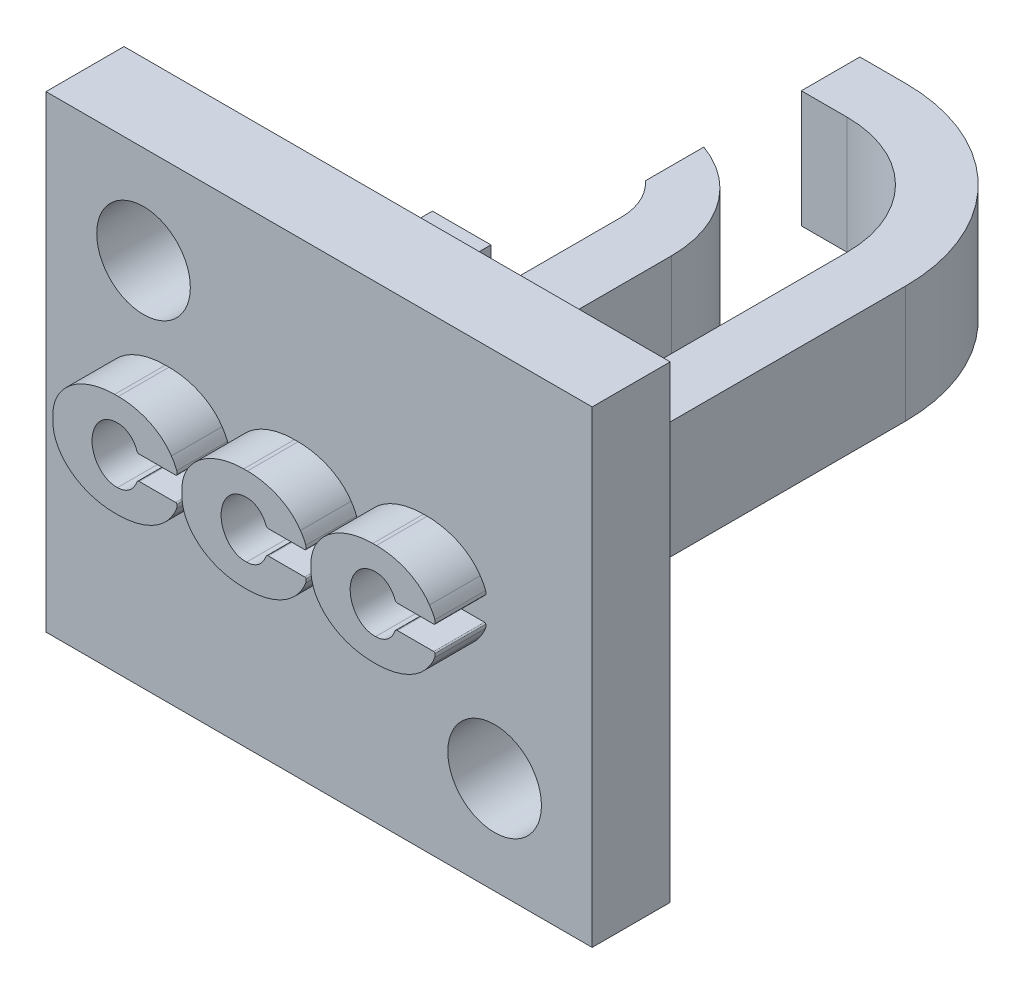
from build123d import *

# Parameters (mm, degrees)
SKETCH1_W           = 15
SKETCH1_H           = 12
BOSS_EXTRUDE1_DEPTH = 2
BOSS_EXTRUDE2_DEPTH = 2
SKETCH3_W           = 1.5
SKETCH3_H           = 4.8
BOSS_EXTRUDE3_DEPTH = 1.5
FILLET3_START       = -1.5
FILLET3_DEPTH       = 3
FILLET4_R           = 3
FILLET5_R           = 3
FILLET6_R           = 4.5
SKETCH4_W           = 2
SKETCH4_H           = 12
CUT_EXTRUDE1_DEPTH  = 1
SKETCH5_R           = 1.2
CUT_EXTRUDE2_DEPTH  = 17.731407672
CUT_EXTRUDE3_START  = -0.7
CUT_EXTRUDE3_DEPTH  = 0.7


with BuildPart() as part:
    # Sketch1 → Boss-Extrude1 (new body)
    with BuildSketch(Plane.XY):
        Rectangle(SKETCH1_W, SKETCH1_H)
    extrude(amount=BOSS_EXTRUDE1_DEPTH)

    # Sketch2 → Boss-Extrude2 (add)
    with BuildSketch(Plane.XY.offset(2)):
        with BuildLine():
            Line((-0.500488048, 0.447210694), (0.435347045, 0.447210694))
            ThreePointArc((0.435347045, 0.447210694), (0.453657173, 0.45529852), (0.464590943, 0.472065344))
            ThreePointArc((0.464590943, 0.472065344), (0.467777397, 0.516057125), (0.460402384, 0.559543208))
            ThreePointArc((0.460402384, 0.559543208), (0.399954535, 0.692528449), (0.323240273, 0.816842321))
            add(Edge.make_bspline(
                [(0.323240273, 0.816842321), (-0.095057279, 1.457976678), (-1.037858727, 1.457976694)],
                knots=[0.342748392, 0.342748392, 0.342748392, 1.381331674, 1.381331674, 1.381331674], degree=2, weights=[1, 0.868170932, 1]))
            Line((-1.037858727, 1.457976694), (-1.131479815, 1.457976694))
            add(Edge.make_bspline(
                [(-1.131479815, 1.457976694), (-2.717136663, 1.457976694), (-2.717136676, 0.206821629)],
                knots=[4.81203319, 4.81203319, 4.81203319, 6.344970318, 6.344970318, 6.344970318], degree=2, weights=[1, 0.720364545, 1]))
            Line((-2.717136676, 0.206821629), (-2.717136676, 0.076691364))
            add(Edge.make_bspline(
                [(-2.717136676, 0.076691364), (-2.717136676, -1.174463735), (-1.131479784, -1.174463712)],
                knots=[3.079807634, 3.079807634, 3.079807634, 4.61274479, 4.61274479, 4.61274479], degree=2, weights=[1, 0.720364535, 1]))
            Line((-1.131479784, -1.174463712), (-1.037858761, -1.174463712))
            add(Edge.make_bspline(
                [(-1.037858761, -1.174463712), (-0.095057289, -1.174463712), (0.323240273, -0.533329339)],
                knots=[1.760260959, 1.760260959, 1.760260959, 2.798844261, 2.798844261, 2.798844261], degree=2, weights=[1, 0.868170926, 1]))
            ThreePointArc((0.323240273, -0.533329339), (0.396990367, -0.414226505), (0.455654338, -0.287013692))
            ThreePointArc((0.455654338, -0.287013692), (0.467247325, -0.238690378), (0.465485217, -0.189027163))
            ThreePointArc((0.465485217, -0.189027163), (0.453480667, -0.168104183), (0.430820669, -0.159833461))
            Line((0.430820669, -0.159833461), (-0.50048808, -0.159833461))
            ThreePointArc((-0.50048808, -0.159833461), (-0.53825591, -0.17183426), (-0.562169449, -0.203434431))
            add(Edge.make_bspline(
                [(-1.058661028, -0.574317984), (-0.693553117, -0.574677188), (-0.562169449, -0.203434431)],
                knots=[5.955155363, 5.955155363, 5.955155363, 7.020735544, 7.020735544, 7.020735544], degree=2, weights=[1, 0.86139323, 1]))
            add(Edge.make_bspline(
                [(-1.118454184, 0.858318186), (-1.740543918, 0.826860552), (-1.710558048, 0.108403064), (-1.680572179, -0.610054424), (-1.058661028, -0.574317984)],
                knots=[3.181025595, 3.181025595, 3.181025595, 4.754799698, 4.754799698, 6.328573801, 6.328573801, 6.328573801], degree=2, weights=[1, 0.706053195, 1, 0.706053195, 1]))
            add(Edge.make_bspline(
                [(-0.562169449, 0.490811684), (-0.70840827, 0.904029734), (-1.118454184, 0.858318186)],
                knots=[2.404042417, 2.404042417, 2.404042417, 3.565685694, 3.565685694, 3.565685694], degree=2, weights=[1, 0.83601209, 1]))
            ThreePointArc((-0.562169449, 0.490811684), (-0.538255894, 0.459211502), (-0.500488048, 0.447210694))
        make_face()
        with BuildLine():
            Line((-3.808792647, 0.447210694), (-2.872957501, 0.447210694))
            ThreePointArc((-2.872957501, 0.447210694), (-2.854647373, 0.45529852), (-2.843713602, 0.472065344))
            ThreePointArc((-2.843713602, 0.472065344), (-2.840527149, 0.516057125), (-2.847902161, 0.559543208))
            ThreePointArc((-2.847902161, 0.559543208), (-2.90835001, 0.692528449), (-2.985064272, 0.816842321))
            add(Edge.make_bspline(
                [(-2.985064272, 0.816842321), (-3.403361825, 1.457976679), (-4.346163273, 1.457976694)],
                knots=[0.342748392, 0.342748392, 0.342748392, 1.381331674, 1.381331674, 1.381331674], degree=2, weights=[1, 0.868170932, 1]))
            Line((-4.346163273, 1.457976694), (-4.43978436, 1.457976694))
            add(Edge.make_bspline(
                [(-4.43978436, 1.457976694), (-6.025441208, 1.457976694), (-6.025441222, 0.206821629)],
                knots=[4.81203319, 4.81203319, 4.81203319, 6.344970318, 6.344970318, 6.344970318], degree=2, weights=[1, 0.720364545, 1]))
            Line((-6.025441222, 0.206821629), (-6.025441222, 0.076691364))
            add(Edge.make_bspline(
                [(-6.025441222, 0.076691364), (-6.025441222, -1.174463735), (-4.439784331, -1.174463712)],
                knots=[6.221400287, 6.221400287, 6.221400287, 7.754337442, 7.754337442, 7.754337442], degree=2, weights=[1, 0.720364536, 1]))
            Line((-4.439784331, -1.174463712), (-4.346163307, -1.174463712))
            add(Edge.make_bspline(
                [(-4.346163307, -1.174463712), (-3.403361835, -1.174463712), (-2.985064272, -0.533329339)],
                knots=[1.760260959, 1.760260959, 1.760260959, 2.798844261, 2.798844261, 2.798844261], degree=2, weights=[1, 0.868170926, 1]))
            ThreePointArc((-2.985064272, -0.533329339), (-2.911314179, -0.414226505), (-2.852650208, -0.287013692))
            ThreePointArc((-2.852650208, -0.287013692), (-2.84105722, -0.238690378), (-2.842819329, -0.189027163))
            ThreePointArc((-2.842819329, -0.189027163), (-2.854823879, -0.168104182), (-2.877483878, -0.159833461))
            Line((-2.877483878, -0.159833461), (-3.808792626, -0.159833461))
            ThreePointArc((-3.808792626, -0.159833461), (-3.846560455, -0.17183426), (-3.870473995, -0.203434431))
            add(Edge.make_bspline(
                [(-4.366965573, -0.574317984), (-4.001857663, -0.574677188), (-3.870473995, -0.203434431)],
                knots=[2.81356271, 2.81356271, 2.81356271, 3.87914289, 3.87914289, 3.87914289], degree=2, weights=[1, 0.86139323, 1]))
            add(Edge.make_bspline(
                [(-4.42675873, 0.858318186), (-5.048848463, 0.826860552), (-5.018862594, 0.108403064), (-4.988876725, -0.610054424), (-4.366965573, -0.574317984)],
                knots=[3.181025595, 3.181025595, 3.181025595, 4.754799698, 4.754799698, 6.328573801, 6.328573801, 6.328573801], degree=2, weights=[1, 0.706053195, 1, 0.706053195, 1]))
            add(Edge.make_bspline(
                [(-3.870473995, 0.490811684), (-4.016712815, 0.904029734), (-4.42675873, 0.858318186)],
                knots=[5.54563507, 5.54563507, 5.54563507, 6.707278348, 6.707278348, 6.707278348], degree=2, weights=[1, 0.83601209, 1]))
            ThreePointArc((-3.870473995, 0.490811684), (-3.846560461, 0.459211518), (-3.808792647, 0.447210694))
        make_face()
        with BuildLine():
            Line((2.807816498, 0.447210694), (3.743651591, 0.447210694))
            ThreePointArc((3.743651591, 0.447210694), (3.761961719, 0.45529852), (3.772895489, 0.472065344))
            ThreePointArc((3.772895489, 0.472065344), (3.776081943, 0.516057125), (3.76870693, 0.559543208))
            ThreePointArc((3.76870693, 0.559543208), (3.708259081, 0.692528449), (3.631544819, 0.816842321))
            add(Edge.make_bspline(
                [(3.631544819, 0.816842321), (3.213247267, 1.457976678), (2.270445819, 1.457976694)],
                knots=[0.342748392, 0.342748392, 0.342748392, 1.381331674, 1.381331674, 1.381331674], degree=2, weights=[1, 0.868170932, 1]))
            Line((2.270445819, 1.457976694), (2.176824731, 1.457976694))
            add(Edge.make_bspline(
                [(2.176824731, 1.457976694), (0.591167883, 1.457976694), (0.59116787, 0.206821629)],
                knots=[4.81203319, 4.81203319, 4.81203319, 6.344970318, 6.344970318, 6.344970318], degree=2, weights=[1, 0.720364545, 1]))
            Line((0.59116787, 0.206821629), (0.59116787, 0.076691364))
            add(Edge.make_bspline(
                [(0.59116787, 0.076691364), (0.59116787, -1.174463735), (2.176824762, -1.174463712)],
                knots=[3.079807634, 3.079807634, 3.079807634, 4.61274479, 4.61274479, 4.61274479], degree=2, weights=[1, 0.720364535, 1]))
            Line((2.176824762, -1.174463712), (2.270445785, -1.174463712))
            add(Edge.make_bspline(
                [(2.270445785, -1.174463712), (3.213247257, -1.174463712), (3.631544819, -0.533329339)],
                knots=[1.760260959, 1.760260959, 1.760260959, 2.798844261, 2.798844261, 2.798844261], degree=2, weights=[1, 0.868170926, 1]))
            ThreePointArc((3.631544819, -0.533329339), (3.705294913, -0.414226505), (3.763958884, -0.287013692))
            ThreePointArc((3.763958884, -0.287013692), (3.775551871, -0.238690378), (3.773789763, -0.189027163))
            ThreePointArc((3.773789763, -0.189027163), (3.761785213, -0.168104183), (3.739125215, -0.159833461))
            Line((3.739125215, -0.159833461), (2.807816466, -0.159833461))
            ThreePointArc((2.807816466, -0.159833461), (2.770048636, -0.17183426), (2.746135097, -0.203434431))
            add(Edge.make_bspline(
                [(2.249643518, -0.574317984), (2.614751429, -0.574677188), (2.746135097, -0.203434431)],
                knots=[2.81356271, 2.81356271, 2.81356271, 3.87914289, 3.87914289, 3.87914289], degree=2, weights=[1, 0.86139323, 1]))
            add(Edge.make_bspline(
                [(2.189850362, 0.858318186), (1.567760628, 0.826860552), (1.597746498, 0.108403064), (1.627732367, -0.610054424), (2.249643518, -0.574317984)],
                knots=[0.039432941, 0.039432941, 0.039432941, 1.613207044, 1.613207044, 3.186981147, 3.186981147, 3.186981147], degree=2, weights=[1, 0.706053195, 1, 0.706053195, 1]))
            add(Edge.make_bspline(
                [(2.746135097, 0.490811684), (2.599896276, 0.904029734), (2.189850362, 0.858318186)],
                knots=[2.404042417, 2.404042417, 2.404042417, 3.565685694, 3.565685694, 3.565685694], degree=2, weights=[1, 0.83601209, 1]))
            ThreePointArc((2.746135097, 0.490811684), (2.770048652, 0.459211502), (2.807816498, 0.447210694))
        make_face()
    extrude(amount=BOSS_EXTRUDE2_DEPTH)

    # Sketch3 → Boss-Extrude3 (add, symmetric)
    with BuildSketch(Plane(origin=(0, 0, 0), x_dir=(1, 0, 0), z_dir=(0, 1, 0))):
        Polygon((1.833716, 0), (3.333716, 0), (3.333716, 13.7), (-2.337662633, 13.7), (-2.337662633, 12.2), (1.833716, 12.2), align=None)
        with Locations((-3.644025381, 2.4)):
            Rectangle(SKETCH3_W, SKETCH3_H)
        Polygon((-1.837662633, 0), (-0.337662633, 0), (-0.337662633, 9.7), (-2.337662633, 9.7), (-2.337662633, 8.2), (-1.837662633, 8.2), align=None)
    extrude(amount=BOSS_EXTRUDE3_DEPTH, both=True)

    # Fillet3: read off the stored shape, not the designer's step
    # Fillet3 outline → Fillet3 (add)
    with BuildSketch(Plane(origin=(0, 0, 0), x_dir=(1, 0, 0), z_dir=(0, 1, 0)).offset(FILLET3_START)):
        with BuildLine():
            Line((-1.837662633, 8.2), (-2.337662633, 8.2))
            ThreePointArc((-2.337662633, 8.2), (-1.968356239, 7.694338447), (-1.837662633, 7.081966011))
            Line((-1.837662633, 7.081966011), (-1.837662633, 8.2))
        make_face()
    extrude(amount=FILLET3_DEPTH)

    # Fillet4
    # the kernel refuses this fillet: 3 mm, written as the material it takes off along each edge
    with BuildSketch(Plane(origin=(-0.337662633, -8.571067812, -9.7), x_dir=(0, 0, 1), z_dir=(0, 1, 0))) as fillet4_piece_1:
        with BuildLine():
            CenterArc((2.828427125, -3), FILLET4_R, 90, 70.528779366)
            Line((0, -2), (-0.056568542, -1.98))
            ThreePointArc((-0.056568542, -1.98), (-0.06, -1), (-0.06, 0))
            Line((-0.06, 0), (0, 0.06))
            Line((0, 0.06), (2.828427125, 0.06))
            Line((2.828427125, 0.06), (2.828427125, 0))
        make_face()
    extrude(amount=17.142135624, mode=Mode.SUBTRACT)

    # Fillet5
    fillet5_edges = [part.edges().sort_by_distance(p)[0] for p in [
        (1.833716, 0, -12.2),
    ]]
    fillet(fillet5_edges, radius=FILLET5_R)

    # Fillet6
    fillet6_edges = [part.edges().sort_by_distance(p)[0] for p in [
        (3.333716, 0, -13.7),
    ]]
    fillet(fillet6_edges, radius=FILLET6_R)

    # Sketch4 → Cut-Extrude1 (cut)
    with BuildSketch(Plane(origin=(7.5, 0, 0), x_dir=(0, 0, -1), z_dir=(1, 0, 0))):
        with Locations((-1, 0)):
            Rectangle(SKETCH4_W, SKETCH4_H)
    extrude(amount=-CUT_EXTRUDE1_DEPTH, mode=Mode.SUBTRACT)

    # Sketch5 → Cut-Extrude2 (cut, through all)
    with BuildSketch(Plane(origin=(0, 0, 0), x_dir=(-1, 0, 0), z_dir=(0, 0, -1))):
        with Locations((-4, -3.5)):
            Circle(SKETCH5_R)
        with Locations((5, 3.5)):
            Circle(SKETCH5_R)
    extrude(amount=-CUT_EXTRUDE2_DEPTH, mode=Mode.SUBTRACT)

    # Sketch6 → Cut-Extrude3 (cut)
    with BuildSketch(Plane.XY.offset(4).offset(CUT_EXTRUDE3_START)):
        with BuildLine():
            Line((-3.808792647, 0.447210694), (-2.872957501, 0.447210694))
            ThreePointArc((-2.872957501, 0.447210694), (-2.854647373, 0.45529852), (-2.843713602, 0.472065344))
            ThreePointArc((-2.843713602, 0.472065344), (-2.840527149, 0.516057125), (-2.847902161, 0.559543208))
            ThreePointArc((-2.847902161, 0.559543208), (-2.90835001, 0.692528449), (-2.985064272, 0.816842321))
            add(Edge.make_bspline(
                [(-2.985064272, 0.816842321), (-3.403361825, 1.457976679), (-4.346163273, 1.457976694)],
                knots=[0.342748392, 0.342748392, 0.342748392, 1.381331674, 1.381331674, 1.381331674], degree=2, weights=[1, 0.868170932, 1]))
            Line((-4.346163273, 1.457976694), (-4.43978436, 1.457976694))
            add(Edge.make_bspline(
                [(-4.43978436, 1.457976694), (-6.025441208, 1.457976694), (-6.025441222, 0.206821629)],
                knots=[4.81203319, 4.81203319, 4.81203319, 6.344970318, 6.344970318, 6.344970318], degree=2, weights=[1, 0.720364545, 1]))
            Line((-6.025441222, 0.206821629), (-6.025441222, 0.076691364))
            add(Edge.make_bspline(
                [(-6.025441222, 0.076691364), (-6.025441222, -1.174463735), (-4.439784331, -1.174463712)],
                knots=[6.221400287, 6.221400287, 6.221400287, 7.754337442, 7.754337442, 7.754337442], degree=2, weights=[1, 0.720364536, 1]))
            Line((-4.439784331, -1.174463712), (-4.346163307, -1.174463712))
            add(Edge.make_bspline(
                [(-4.346163307, -1.174463712), (-3.403361835, -1.174463712), (-2.985064272, -0.533329339)],
                knots=[1.760260959, 1.760260959, 1.760260959, 2.798844261, 2.798844261, 2.798844261], degree=2, weights=[1, 0.868170926, 1]))
            ThreePointArc((-2.985064272, -0.533329339), (-2.911314179, -0.414226505), (-2.852650208, -0.287013692))
            ThreePointArc((-2.852650208, -0.287013692), (-2.84105722, -0.238690378), (-2.842819329, -0.189027163))
            ThreePointArc((-2.842819329, -0.189027163), (-2.854823879, -0.168104182), (-2.877483878, -0.159833461))
            Line((-2.877483878, -0.159833461), (-3.808792626, -0.159833461))
            ThreePointArc((-3.808792626, -0.159833461), (-3.846560455, -0.17183426), (-3.870473995, -0.203434431))
            add(Edge.make_bspline(
                [(-4.366965573, -0.574317984), (-4.001857663, -0.574677188), (-3.870473995, -0.203434431)],
                knots=[5.955155363, 5.955155363, 5.955155363, 7.020735544, 7.020735544, 7.020735544], degree=2, weights=[1, 0.86139323, 1]))
            add(Edge.make_bspline(
                [(-4.42675873, 0.858318186), (-5.048848463, 0.826860552), (-5.018862594, 0.108403064), (-4.988876725, -0.610054424), (-4.366965573, -0.574317984)],
                knots=[3.181025595, 3.181025595, 3.181025595, 4.754799698, 4.754799698, 6.328573801, 6.328573801, 6.328573801], degree=2, weights=[1, 0.706053195, 1, 0.706053195, 1]))
            add(Edge.make_bspline(
                [(-3.870473995, 0.490811684), (-4.016712815, 0.904029734), (-4.42675873, 0.858318186)],
                knots=[2.404042417, 2.404042417, 2.404042417, 3.565685694, 3.565685694, 3.565685694], degree=2, weights=[1, 0.83601209, 1]))
            ThreePointArc((-3.870473995, 0.490811684), (-3.846560461, 0.459211518), (-3.808792647, 0.447210694))
        make_face()
        with BuildLine():
            Line((-0.500488048, 0.447210694), (0.435347045, 0.447210694))
            ThreePointArc((0.435347045, 0.447210694), (0.453657173, 0.45529852), (0.464590943, 0.472065344))
            ThreePointArc((0.464590943, 0.472065344), (0.467777397, 0.516057125), (0.460402384, 0.559543208))
            ThreePointArc((0.460402384, 0.559543208), (0.399954535, 0.692528449), (0.323240273, 0.816842321))
            add(Edge.make_bspline(
                [(0.323240273, 0.816842321), (-0.095057279, 1.457976678), (-1.037858727, 1.457976694)],
                knots=[0.342748392, 0.342748392, 0.342748392, 1.381331674, 1.381331674, 1.381331674], degree=2, weights=[1, 0.868170932, 1]))
            Line((-1.037858727, 1.457976694), (-1.131479815, 1.457976694))
            add(Edge.make_bspline(
                [(-1.131479815, 1.457976694), (-2.717136663, 1.457976694), (-2.717136676, 0.206821629)],
                knots=[4.81203319, 4.81203319, 4.81203319, 6.344970318, 6.344970318, 6.344970318], degree=2, weights=[1, 0.720364545, 1]))
            Line((-2.717136676, 0.206821629), (-2.717136676, 0.076691364))
            add(Edge.make_bspline(
                [(-2.717136676, 0.076691364), (-2.717136676, -1.174463735), (-1.131479784, -1.174463712)],
                knots=[3.079807634, 3.079807634, 3.079807634, 4.61274479, 4.61274479, 4.61274479], degree=2, weights=[1, 0.720364535, 1]))
            Line((-1.131479784, -1.174463712), (-1.037858761, -1.174463712))
            add(Edge.make_bspline(
                [(-1.037858761, -1.174463712), (-0.095057289, -1.174463712), (0.323240273, -0.533329339)],
                knots=[1.760260959, 1.760260959, 1.760260959, 2.798844261, 2.798844261, 2.798844261], degree=2, weights=[1, 0.868170926, 1]))
            ThreePointArc((0.323240273, -0.533329339), (0.396990367, -0.414226505), (0.455654338, -0.287013692))
            ThreePointArc((0.455654338, -0.287013692), (0.467247325, -0.238690378), (0.465485217, -0.189027163))
            ThreePointArc((0.465485217, -0.189027163), (0.453480667, -0.168104183), (0.430820669, -0.159833461))
            Line((0.430820669, -0.159833461), (-0.50048808, -0.159833461))
            ThreePointArc((-0.50048808, -0.159833461), (-0.53825591, -0.17183426), (-0.562169449, -0.203434431))
            add(Edge.make_bspline(
                [(-1.058661028, -0.574317984), (-0.693553117, -0.574677188), (-0.562169449, -0.203434431)],
                knots=[5.955155363, 5.955155363, 5.955155363, 7.020735544, 7.020735544, 7.020735544], degree=2, weights=[1, 0.86139323, 1]))
            add(Edge.make_bspline(
                [(-1.118454184, 0.858318186), (-1.740543918, 0.826860552), (-1.710558048, 0.108403064), (-1.680572179, -0.610054424), (-1.058661028, -0.574317984)],
                knots=[3.181025595, 3.181025595, 3.181025595, 4.754799698, 4.754799698, 6.328573801, 6.328573801, 6.328573801], degree=2, weights=[1, 0.706053195, 1, 0.706053195, 1]))
            add(Edge.make_bspline(
                [(-0.562169449, 0.490811684), (-0.70840827, 0.904029734), (-1.118454184, 0.858318186)],
                knots=[2.404042417, 2.404042417, 2.404042417, 3.565685694, 3.565685694, 3.565685694], degree=2, weights=[1, 0.83601209, 1]))
            ThreePointArc((-0.562169449, 0.490811684), (-0.538255894, 0.459211502), (-0.500488048, 0.447210694))
        make_face()
        with BuildLine():
            Line((2.807816498, 0.447210694), (3.743651591, 0.447210694))
            ThreePointArc((3.743651591, 0.447210694), (3.761961719, 0.45529852), (3.772895489, 0.472065344))
            ThreePointArc((3.772895489, 0.472065344), (3.776081943, 0.516057125), (3.76870693, 0.559543208))
            ThreePointArc((3.76870693, 0.559543208), (3.708259081, 0.692528449), (3.631544819, 0.816842321))
            add(Edge.make_bspline(
                [(3.631544819, 0.816842321), (3.213247267, 1.457976678), (2.270445819, 1.457976694)],
                knots=[0.342748392, 0.342748392, 0.342748392, 1.381331674, 1.381331674, 1.381331674], degree=2, weights=[1, 0.868170932, 1]))
            Line((2.270445819, 1.457976694), (2.176824731, 1.457976694))
            add(Edge.make_bspline(
                [(2.176824731, 1.457976694), (0.591167883, 1.457976694), (0.59116787, 0.206821629)],
                knots=[4.81203319, 4.81203319, 4.81203319, 6.344970318, 6.344970318, 6.344970318], degree=2, weights=[1, 0.720364545, 1]))
            Line((0.59116787, 0.206821629), (0.59116787, 0.076691364))
            add(Edge.make_bspline(
                [(0.59116787, 0.076691364), (0.59116787, -1.174463735), (2.176824762, -1.174463712)],
                knots=[3.079807634, 3.079807634, 3.079807634, 4.61274479, 4.61274479, 4.61274479], degree=2, weights=[1, 0.720364535, 1]))
            Line((2.176824762, -1.174463712), (2.270445785, -1.174463712))
            add(Edge.make_bspline(
                [(2.270445785, -1.174463712), (3.213247257, -1.174463712), (3.631544819, -0.533329339)],
                knots=[1.760260959, 1.760260959, 1.760260959, 2.798844261, 2.798844261, 2.798844261], degree=2, weights=[1, 0.868170926, 1]))
            ThreePointArc((3.631544819, -0.533329339), (3.705294913, -0.414226505), (3.763958884, -0.287013692))
            ThreePointArc((3.763958884, -0.287013692), (3.775551871, -0.238690378), (3.773789763, -0.189027163))
            ThreePointArc((3.773789763, -0.189027163), (3.761785213, -0.168104183), (3.739125215, -0.159833461))
            Line((3.739125215, -0.159833461), (2.807816466, -0.159833461))
            ThreePointArc((2.807816466, -0.159833461), (2.770048636, -0.17183426), (2.746135097, -0.203434431))
            add(Edge.make_bspline(
                [(2.249643518, -0.574317984), (2.614751429, -0.574677188), (2.746135097, -0.203434431)],
                knots=[5.955155363, 5.955155363, 5.955155363, 7.020735544, 7.020735544, 7.020735544], degree=2, weights=[1, 0.86139323, 1]))
            add(Edge.make_bspline(
                [(2.189850362, 0.858318186), (1.567760628, 0.826860552), (1.597746498, 0.108403064), (1.627732367, -0.610054424), (2.249643518, -0.574317984)],
                knots=[3.181025595, 3.181025595, 3.181025595, 4.754799698, 4.754799698, 6.328573801, 6.328573801, 6.328573801], degree=2, weights=[1, 0.706053195, 1, 0.706053195, 1]))
            add(Edge.make_bspline(
                [(2.746135097, 0.490811684), (2.599896276, 0.904029734), (2.189850362, 0.858318186)],
                knots=[2.404042417, 2.404042417, 2.404042417, 3.565685694, 3.565685694, 3.565685694], degree=2, weights=[1, 0.83601209, 1]))
            ThreePointArc((2.746135097, 0.490811684), (2.770048652, 0.459211502), (2.807816498, 0.447210694))
        make_face()
    extrude(amount=CUT_EXTRUDE3_DEPTH, mode=Mode.SUBTRACT)


solid = part.part
